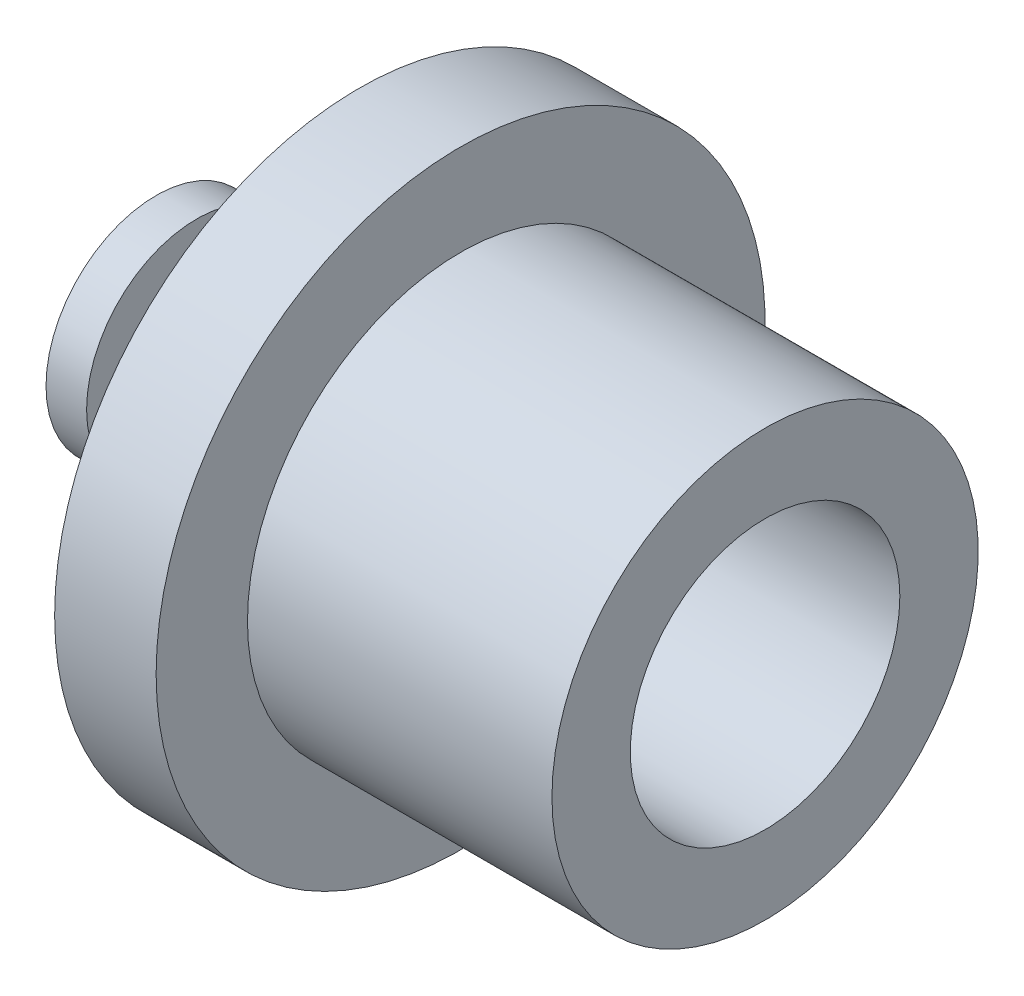
from build123d import *

# Parameters (mm, degrees)
PIPE_TAP_DRILL_FOR_1_8_TAP1_D       = 8.4328
PIPE_TAP_DRILL_FOR_1_8_TAP1_DEPTH   = 9.525
PIPE_TAP_DRILL_FOR_1_8_TAP1_TIP     = 2.533468714
F_3_32_0_09375_DIAMETER_HOLE2_D     = 2.38125
F_3_32_0_09375_DIAMETER_HOLE2_DEPTH = 12.7
F_3_32_0_09375_DIAMETER_HOLE2_TIP   = 0.715399675


with BuildPart() as part:
    # Sketch1 → Revolve1 (revolve)
    with BuildSketch(Plane.XY):
        Polygon((6.35, 3.444875), (6.35, 9.525), (9.525, 9.525), (9.525, 6.6675), (19.05, 6.6675), (19.05, 0), (0, 0), (0, 3.444875), (1.27, 3.444875), (1.27, 2.073275), (3.81, 2.073275), (3.81, 3.444875), align=None)
    revolve(axis=Axis((0, 0, 0), (1, 0, 0)))

    # Pipe Tap Drill for 1/8 Tap1
    with Locations(Plane(origin=(19.05, 0, 0), x_dir=(0, 0, -1), z_dir=(1, 0, 0))):
        with Locations((0, 0)):
            Hole(PIPE_TAP_DRILL_FOR_1_8_TAP1_D / 2, depth=PIPE_TAP_DRILL_FOR_1_8_TAP1_DEPTH)
            with Locations((0, 0, -(PIPE_TAP_DRILL_FOR_1_8_TAP1_DEPTH + PIPE_TAP_DRILL_FOR_1_8_TAP1_TIP / 2))):  # 118° drill point
                Cone(0, PIPE_TAP_DRILL_FOR_1_8_TAP1_D / 2, PIPE_TAP_DRILL_FOR_1_8_TAP1_TIP, mode=Mode.SUBTRACT)

    # 3/32 (0.09375) Diameter Hole2
    with Locations(Plane.ZY):
        with Locations((0, 0)):
            Hole(F_3_32_0_09375_DIAMETER_HOLE2_D / 2, depth=F_3_32_0_09375_DIAMETER_HOLE2_DEPTH)
            with Locations((0, 0, -(F_3_32_0_09375_DIAMETER_HOLE2_DEPTH + F_3_32_0_09375_DIAMETER_HOLE2_TIP / 2))):  # 118° drill point
                Cone(0, F_3_32_0_09375_DIAMETER_HOLE2_D / 2, F_3_32_0_09375_DIAMETER_HOLE2_TIP, mode=Mode.SUBTRACT)


solid = part.part
